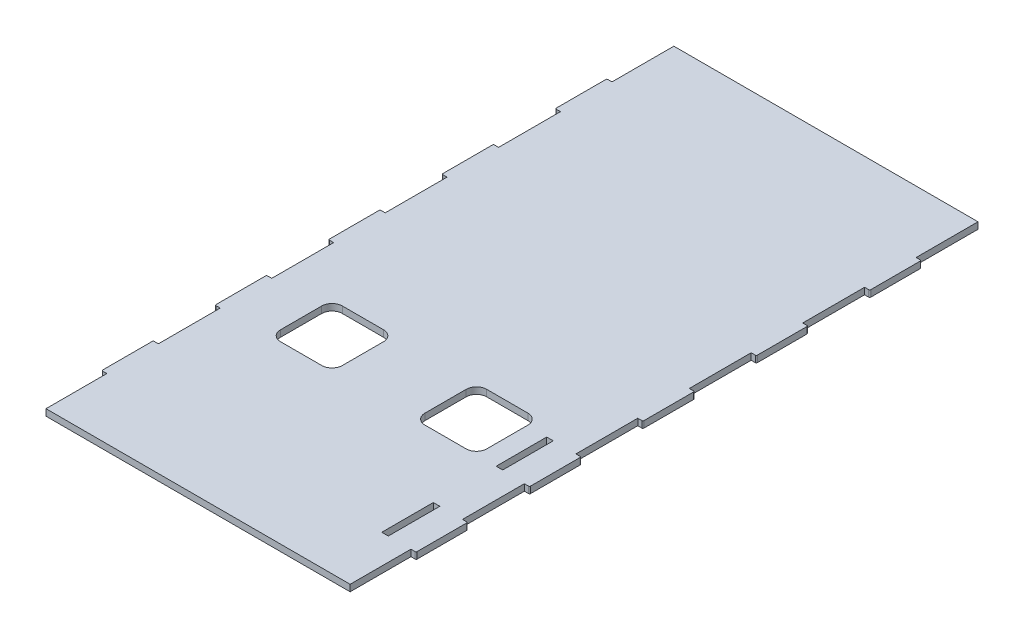
from build123d import *

# Parameters (mm, degrees)
SKETCH1_W           = 6.35
SKETCH1_H           = 50
SKETCH1_H_2         = 49
BOSS_EXTRUDE1_DEPTH = 6.35
FILLET1_R           = 1


with BuildPart() as part:
    # Sketch1 → Boss-Extrude1 (new body)
    with BuildSketch(Plane(origin=(0, 0, 0), x_dir=(1, 0, 0), z_dir=(0, 1, 0))):
        Polygon((157.073624902, 348.621301651), (157.073624902, 288.621301651), (162.073624902, 288.621300264), (162.085917882, 238.621301775), (157.085917882, 238.621301775), (157.085917882, 178.621301775), (162.085917882, 178.621301775), (162.085917882, 128.621301775), (157.085917882, 128.621301775), (157.085917882, 68.621301775), (162.085917882, 68.621301775), (162.085917882, 18.621301775), (157.085917882, 18.621301775), (157.085917882, -41.378698225), (162.085917882, -41.378698225), (162.085917882, -91.378698225), (157.085917882, -91.378698225), (157.085917882, -151.378698225), (162.085917882, -151.378698225), (162.085917882, -201.378698225), (157.085917882, -201.378698225), (157.085917882, -260.378698225), (-137.914082118, -260.378698225), (-137.914082118, -201.378698225), (-142.926375098, -201.378698225), (-142.926375098, -151.378698225), (-137.914082118, -151.378698225), (-137.914082118, -91.378698225), (-142.926375098, -91.378698225), (-142.926375098, -41.378698225), (-137.926375098, -41.378698225), (-137.926375098, 18.621301775), (-142.938668078, 18.621301775), (-142.938668078, 68.621301775), (-137.926375098, 68.621301775), (-137.926375098, 128.621301775), (-142.938668078, 128.621301775), (-142.938668078, 178.621301775), (-137.926375098, 178.621301775), (-137.926375098, 238.621301775), (-142.938668078, 238.621301775), (-142.938668078, 288.621301775), (-137.926375098, 288.621301775), (-137.926375098, 348.621301651), align=None)
        with BuildLine():
            Line((-80.468838102, -30.378698225), (-40.468838102, -30.378698225))
            ThreePointArc((-40.468838102, -30.378698225), (-33.39777029, -33.307630413), (-30.468838102, -40.378698225))
            Line((-30.468838102, -40.378698225), (-30.468838102, -80.378698225))
            ThreePointArc((-30.468838102, -80.378698225), (-33.39777029, -87.449766037), (-40.468838102, -90.378698225))
            Line((-40.468838102, -90.378698225), (-80.468838102, -90.378698225))
            ThreePointArc((-80.468838102, -90.378698225), (-87.539905914, -87.449766037), (-90.468838102, -80.378698225))
            Line((-90.468838102, -80.378698225), (-90.468838102, -40.378698225))
            ThreePointArc((-90.468838102, -40.378698225), (-87.539905914, -33.307630413), (-80.468838102, -30.378698225))
        make_face(mode=Mode.SUBTRACT)
        with BuildLine():
            Line((59.585917882, -30.378698225), (99.585917882, -30.378698225))
            ThreePointArc((99.585917882, -30.378698225), (106.656985694, -33.307630413), (109.585917882, -40.378698225))
            Line((109.585917882, -40.378698225), (109.585917882, -80.378698225))
            ThreePointArc((109.585917882, -80.378698225), (106.656985694, -87.449766037), (99.585917882, -90.378698225))
            Line((99.585917882, -90.378698225), (59.585917882, -90.378698225))
            ThreePointArc((59.585917882, -90.378698225), (52.51485007, -87.449766037), (49.585917882, -80.378698225))
            Line((49.585917882, -80.378698225), (49.585917882, -40.378698225))
            ThreePointArc((49.585917882, -40.378698225), (52.51485007, -33.307630413), (59.585917882, -30.378698225))
        make_face(mode=Mode.SUBTRACT)
        with Locations((131.910917882, -176.378698225)):
            Rectangle(SKETCH1_W, SKETCH1_H, mode=Mode.SUBTRACT)
        with Locations((131.910917882, -65.878698225)):
            Rectangle(SKETCH1_W, SKETCH1_H_2, mode=Mode.SUBTRACT)
    extrude(amount=BOSS_EXTRUDE1_DEPTH)

    # Fillet1
    fillet1_edges = [part.edges().sort_by_distance(p)[0] for p in [
        (-142.938668078, 3.175, -288.621301775),
        (-142.938668078, 3.175, -238.621301775),
        (-142.938668078, 3.175, -178.621301775),
        (-142.938668078, 3.175, -128.621301775),
        (-142.938668078, 3.175, -68.621301775),
        (-142.938668078, 3.175, -18.621301775),
        (-142.926375098, 3.175, 41.378698225),
        (-142.926375098, 3.175, 91.378698225),
        (-140.420228608, 0, 151.378698225),
        (-142.926375098, 3.175, 201.378698225),
        (162.073624902, 3.175, -288.621300264),
        (162.085917882, 3.175, -238.621301775),
        (162.085917882, 3.175, -178.621301775),
        (162.085917882, 3.175, -128.621301775),
        (162.085917882, 3.175, -68.621301775),
        (162.085917882, 3.175, -18.621301775),
        (162.085917882, 3.175, 41.378698225),
        (162.085917882, 3.175, 91.378698225),
        (162.085917882, 3.175, 151.378698225),
        (162.085917882, 3.175, 201.378698225),
    ]]
    fillet(fillet1_edges, radius=FILLET1_R)


solid = part.part
